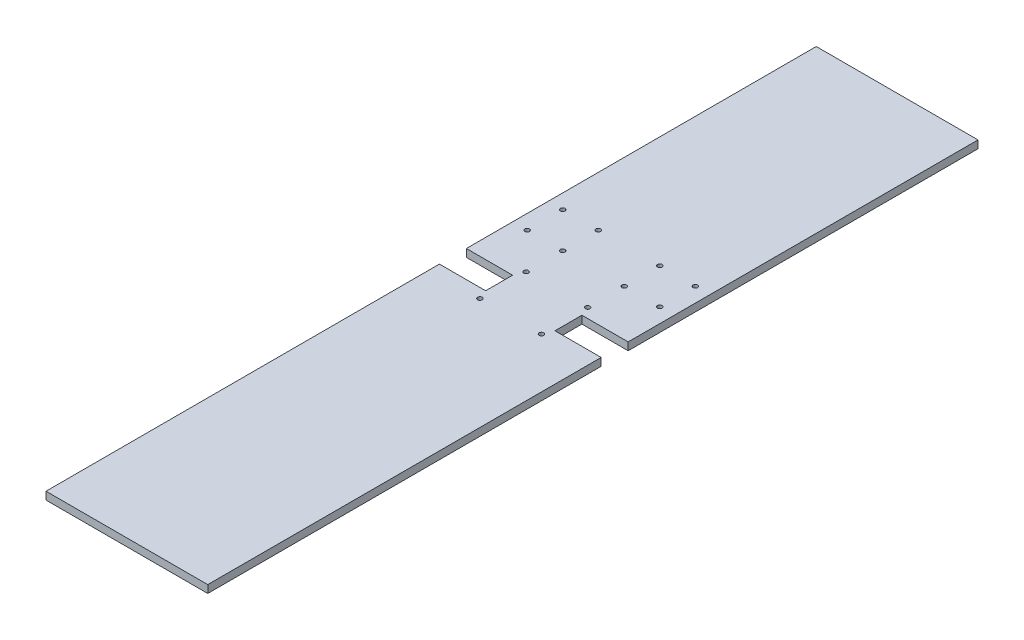
from build123d import *

# Parameters (mm, degrees)
SKETCH1_R             = 1.5
BOSS_EXTRUDE1_DEPTH   = 5
F_3_0MM_DOWEL_HOLE1_D = 3


with BuildPart() as part:
    # Sketch1 → Boss-Extrude1 (new body)
    with BuildSketch(Plane(origin=(0, 0, 0), x_dir=(1, 0, 0), z_dir=(0, 1, 0))):
        Polygon((-52.5, 235.863079758), (-52.5, 8.75), (-22.5, 8.75), (-22.5, -8.75), (-52.5, -8.75), (-52.5, -264.136920242), (52.5, -264.136920242), (52.5, -8.75), (22.5, -8.75), (22.5, 8.75), (52.5, 8.75), (52.5, 235.863079758), align=None)
        with Locations((-20, 15)):
            Circle(SKETCH1_R, mode=Mode.SUBTRACT)
        with Locations((20, 15)):
            Circle(SKETCH1_R, mode=Mode.SUBTRACT)
        with Locations((20, -15)):
            Circle(SKETCH1_R, mode=Mode.SUBTRACT)
        with Locations((-20, -15)):
            Circle(SKETCH1_R, mode=Mode.SUBTRACT)
    extrude(amount=BOSS_EXTRUDE1_DEPTH)

    # Ø3.0mm Dowel Hole1 (through all)
    with Locations(Plane(origin=(0, 5, 0), x_dir=(1, 0, 0), z_dir=(0, 1, 0))):
        with Locations((-20, 38.75), (-43.08, 61.83), (-20, 61.83), (-43.08, 38.75), (20, 61.83), (43.08, 61.83), (20, 38.75), (43.08, 38.75)):
            Hole(F_3_0MM_DOWEL_HOLE1_D / 2)


solid = part.part
